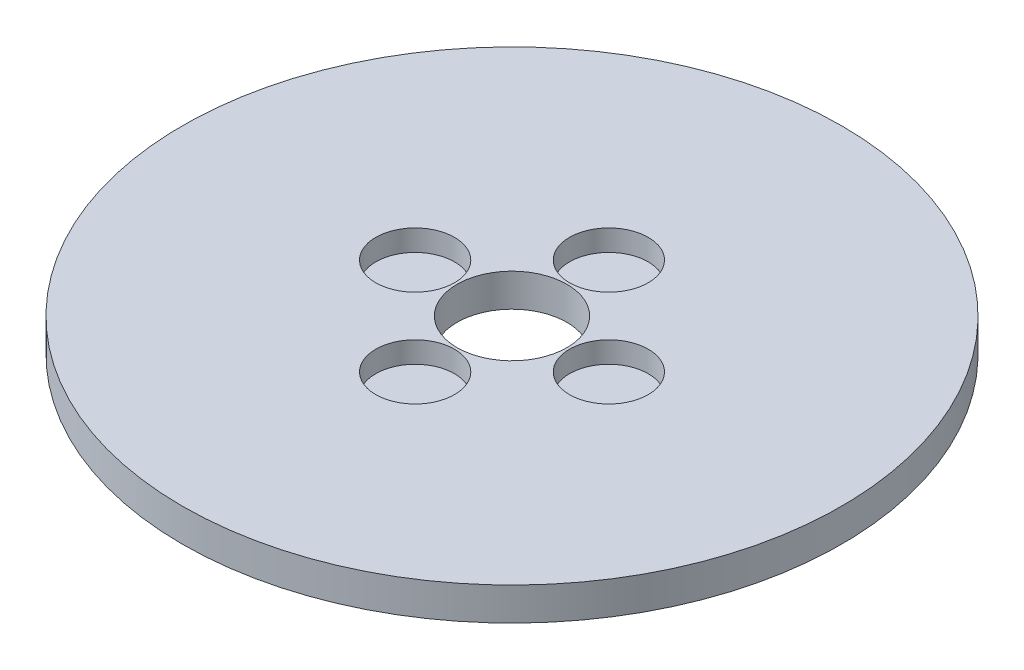
from build123d import *

# Parameters (mm, degrees)
SKETCH1_R           = 60
BOSS_EXTRUDE1_DEPTH = 6
SKETCH2_R           = 10
CUT_EXTRUDE1_DEPTH  = 86.064681273
SKETCH3_R           = 7.167138737
CUT_EXTRUDE2_DEPTH  = 3.8660744
CIRPATTERN1_COUNT   = 4


with BuildPart() as part:
    # Sketch1 → Boss-Extrude1 (new body)
    with BuildSketch(Plane(origin=(0, 0, 0), x_dir=(1, 0, 0), z_dir=(0, 1, 0))):
        Circle(SKETCH1_R)
    extrude(amount=BOSS_EXTRUDE1_DEPTH)

    # Sketch2 → Cut-Extrude1 (cut, through all)
    with BuildSketch(Plane(origin=(0, 0, 0), x_dir=(1, 0, 0), z_dir=(0, 1, 0))):
        Circle(SKETCH2_R)
    extrude(amount=CUT_EXTRUDE1_DEPTH, mode=Mode.SUBTRACT)

    # Sketch3 → Cut-Extrude2 (cut)
    with BuildSketch(Plane(origin=(0, 6, 0), x_dir=(1, 0, 0), z_dir=(0, 1, 0))):
        with Locations((-17.634831482, 0)):
            Circle(SKETCH3_R)
    cut_extrude2 = extrude(amount=-CUT_EXTRUDE2_DEPTH, mode=Mode.SUBTRACT)

    # CirPattern1: Cut-Extrude2 ×4 about axis
    cirpattern1_axis = Axis((0, 0, 0), (0, 1, 0))
    for i in range(1, CIRPATTERN1_COUNT):
        add(cut_extrude2.rotate(cirpattern1_axis, i * 360 / CIRPATTERN1_COUNT), mode=Mode.SUBTRACT)


solid = part.part
